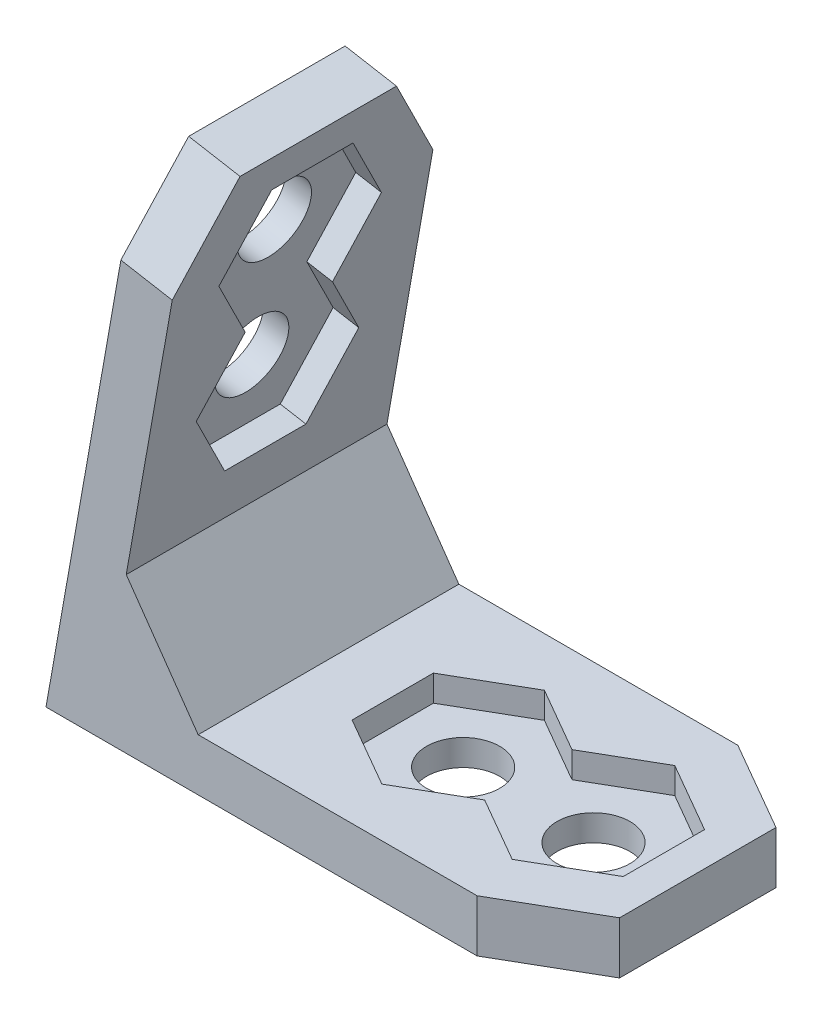
from build123d import *

# Parameters (mm, degrees)
SKETCH1_W           = 25.4
SKETCH1_H           = 12.7
BOSS_EXTRUDE1_DEPTH = 2.54
CUT_EXTRUDE1_DEPTH  = 29.511429287
CHAMFER1_SIZE2      = 3.027054125
CHAMFER1_SIZE       = 2.54
SKETCH4_R           = 1.778
CUT_EXTRUDE2_DEPTH  = 1.27
CHAMFER3_SIZE       = 2.54
CHAMFER3_SIZE2      = 4.399409051
CHAMFER2_SIZE       = 5.08
CHAMFER2_SIZE2      = 4.385147389


with BuildPart() as part:
    # Sketch1 → Boss-Extrude1 (new body)
    with BuildSketch(Plane(origin=(0, 0, 0), x_dir=(1, 0, 0), z_dir=(0, 1, 0))):
        with Locations((12.7, -6.35)):
            Rectangle(SKETCH1_W, SKETCH1_H)
    extrude(amount=BOSS_EXTRUDE1_DEPTH)

    # Sketch2 → Cut-Extrude1 (cut, through all)
    with BuildSketch(Plane(origin=(0, 2.54, 0), x_dir=(1, 0, 0), z_dir=(0, 1, 0))):
        with BuildLine():
            ThreePointArc((22.098, -6.35), (20.32, -4.572), (18.542, -6.35))
            Line((18.542, -6.35), (22.098, -6.35))
        make_face()
        with BuildLine():
            Line((22.098, -6.35), (18.542, -6.35))
            ThreePointArc((18.542, -6.35), (20.32, -8.128), (22.098, -6.35))
        make_face()
        with BuildLine():
            ThreePointArc((15.748, -6.35), (13.97, -4.572), (12.192, -6.35))
            Line((12.192, -6.35), (15.748, -6.35))
        make_face()
        with BuildLine():
            Line((15.748, -6.35), (12.192, -6.35))
            ThreePointArc((12.192, -6.35), (13.97, -8.128), (15.748, -6.35))
        make_face()
    extrude(amount=-CUT_EXTRUDE1_DEPTH, mode=Mode.SUBTRACT)

    # Chamfer1
    chamfer1_edges = [part.edges().sort_by_distance(p)[0] for p in [
        (0, 2.54, 6.35),
    ]]
    chamfer1_side = [part.faces().sort_by_distance(p)[0] for p in [
        (0, 2.4892, 6.35),
    ]]
    chamfer(chamfer1_edges, length=CHAMFER1_SIZE - 0.0001, length2=CHAMFER1_SIZE2 - 0.0001, reference=chamfer1_side[0])  # a hair under: the kernel refuses the full size

    # Sketch4 → Cut-Extrude2 (cut)
    # profile 1 of 3: a face of its own
    with BuildSketch(Plane(origin=(0, 2.54, 0), x_dir=(1, 0, 0), z_dir=(0, 1, 0))):
        Polygon((17.145, -4.223618959), (13.97, -2.390531854), (10.541, -4.370265927), (10.541, -8.329734073), (13.97, -10.309468146), (17.145, -8.476381041), (16.891, -8.329734073), (16.891, -4.370265927), align=None)
        with Locations(Location((13.97, -6.35, 0), (0, 0, 270))):
            Circle(SKETCH4_R, mode=Mode.SUBTRACT)
    # profile 2 of 3: a face of its own
    with BuildSketch(Plane(origin=(0, 2.54, 0), x_dir=(1, 0, 0), z_dir=(0, 1, 0))):
        Polygon((20.32, -2.390531854), (17.145, -4.223618959), (17.399, -4.370265927), (17.399, -8.329734073), (17.145, -8.476381041), (20.32, -10.309468146), (23.749, -8.329734073), (23.749, -4.370265927), align=None)
        with Locations(Location((20.32, -6.35, 0), (0, 0, 270))):
            Circle(SKETCH4_R, mode=Mode.SUBTRACT)
    # profile 3 of 3: a face of its own
    with BuildSketch(Plane(origin=(0, 2.54, 0), x_dir=(1, 0, 0), z_dir=(0, 1, 0))):
        Polygon((17.399, -4.370265927), (17.145, -4.223618959), (16.891, -4.370265927), (16.891, -8.329734073), (17.145, -8.476381041), (17.399, -8.329734073), align=None)
    extrude(amount=-CUT_EXTRUDE2_DEPTH, mode=Mode.SUBTRACT)

    # Chamfer3
    chamfer3_edges = [part.edges().sort_by_distance(p)[0] for p in [
        (25.4, 1.27, 0),
        (25.4, 1.27, 12.7),
    ]]
    chamfer3_side = [part.faces().sort_by_distance(p)[0] for p in [
        (25.4, 1.27, 6.35),
    ]]
    chamfer(chamfer3_edges, length=CHAMFER3_SIZE, length2=CHAMFER3_SIZE2, reference=chamfer3_side[0])

    # Mirror1: part across plane


with BuildPart() as part_1:
    add(part.part)
    add(part.part.mirror(Plane(origin=(3.027054125, 2.54, 0), x_dir=(0, 0, 1), z_dir=(-0.6427876096865399, 0.7660444431189777, 0))))

    # Chamfer2
    chamfer2_edges = [part_1.edges().sort_by_distance(p)[0] for p in [
        (3.026954125, 2.54, 6.35),
    ]]
    chamfer2_side = [part_1.faces().sort_by_distance(p)[0] for p in [
        (4.587581401, 11.390189966, 0.257263255),
    ]]
    chamfer(chamfer2_edges, length=CHAMFER2_SIZE, length2=CHAMFER2_SIZE2, reference=chamfer2_side[0])


solid = part_1.part
